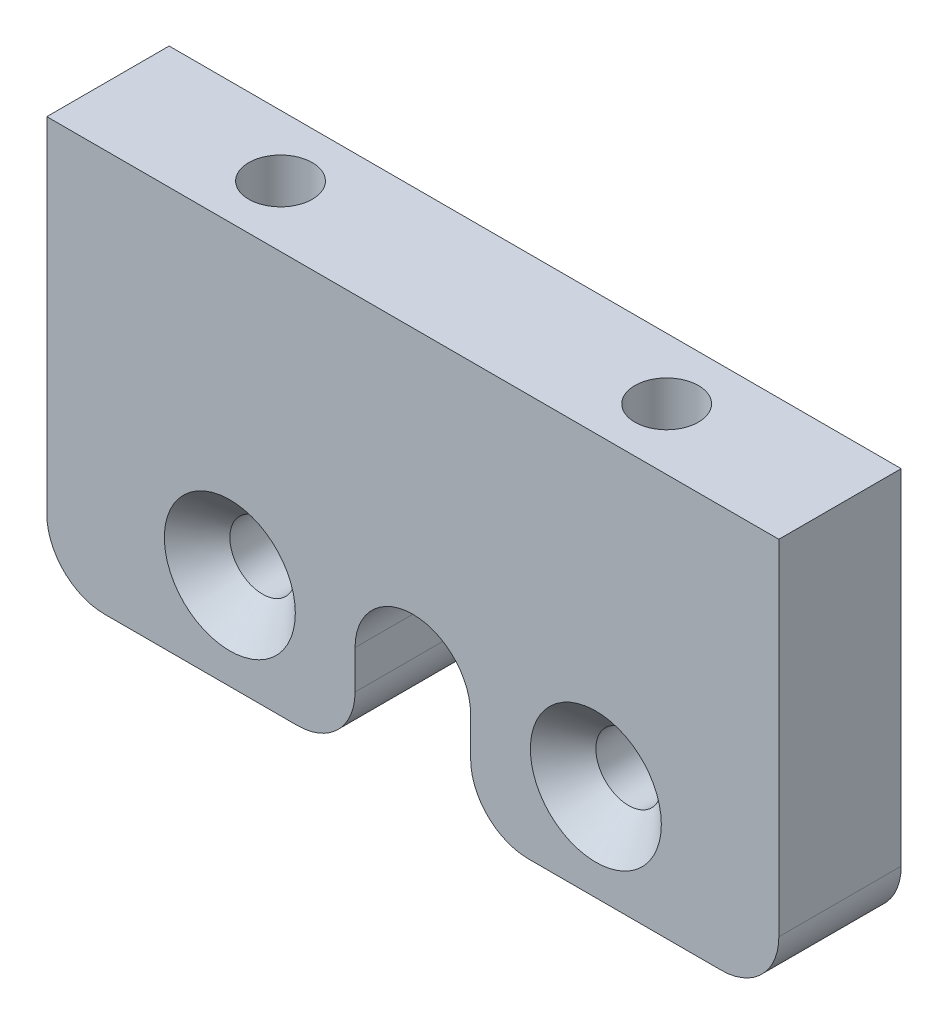
from build123d import *

# Parameters (mm, degrees)
SKETCH1_R           = 1.7
BOSS_EXTRUDE1_DEPTH = 6.35
CHAMFER1_SIZE       = 1.7
SKETCH2_R           = 1.65
CUT_EXTRUDE1_DEPTH  = 10
FILLET1_R           = 3


with BuildPart() as part:
    # Sketch1 → Boss-Extrude1 (new body)
    with BuildSketch(Plane(origin=(1.16e-07, 0, -33.253697298), x_dir=(1.0, 0, 3.501429786466588e-09), z_dir=(-3.501429786466588e-09, 0, 1.0))):
        with BuildLine():
            Line((3.00000025, 6.9987), (3.00000025, 1.9987))
            Line((3.00000025, 1.9987), (19.00000025, 1.9987))
            Line((19.00000025, 1.9987), (19.00000025, 22.8687))
            Line((19.00000025, 22.8687), (-19.00000025, 22.8687))
            Line((-19.00000025, 22.8687), (-19.00000025, 1.9987))
            Line((-19.00000025, 1.9987), (-3.00000025, 1.9987))
            Line((-3.00000025, 1.9987), (-3.00000025, 6.9987))
            ThreePointArc((-3.00000025, 6.9987), (2.5e-07, 9.9987), (3.00000025, 6.9987))
        make_face()
        with Locations((9.49999975, 6.9987)):
            Circle(SKETCH1_R, mode=Mode.SUBTRACT)
        with Locations((-9.49999975, 6.9987)):
            Circle(SKETCH1_R, mode=Mode.SUBTRACT)
    extrude(amount=BOSS_EXTRUDE1_DEPTH)

    # Chamfer1
    chamfer1_edges = [part.edges().sort_by_distance(p)[0] for p in [
        (-11.199999655, 6.9987, -26.903697337),
        (7.799999844, 6.9987, -26.90369727),
    ]]
    chamfer(chamfer1_edges, length=CHAMFER1_SIZE)

    # Sketch2 → Cut-Extrude1 (cut)
    with BuildSketch(Plane(origin=(0, 22.8687, 0), x_dir=(1, 0, 0), z_dir=(0, 1, 0))):
        with Locations((10, 30.078697231)):
            Circle(SKETCH2_R)
        with Locations((-10.042850258, 30.078697231)):
            Circle(SKETCH2_R)
    extrude(amount=-CUT_EXTRUDE1_DEPTH, mode=Mode.SUBTRACT)

    # Fillet1
    fillet1_edges = [part.edges().sort_by_distance(p)[0] for p in [
        (-19.000000145, 1.9987, -30.078697364),
        (-3.000000145, 1.9987, -30.078697308),
        (3.000000356, 1.9987, -30.078697287),
        (19.000000356, 1.9987, -30.078697231),
    ]]
    fillet(fillet1_edges, radius=FILLET1_R)


solid = part.part
